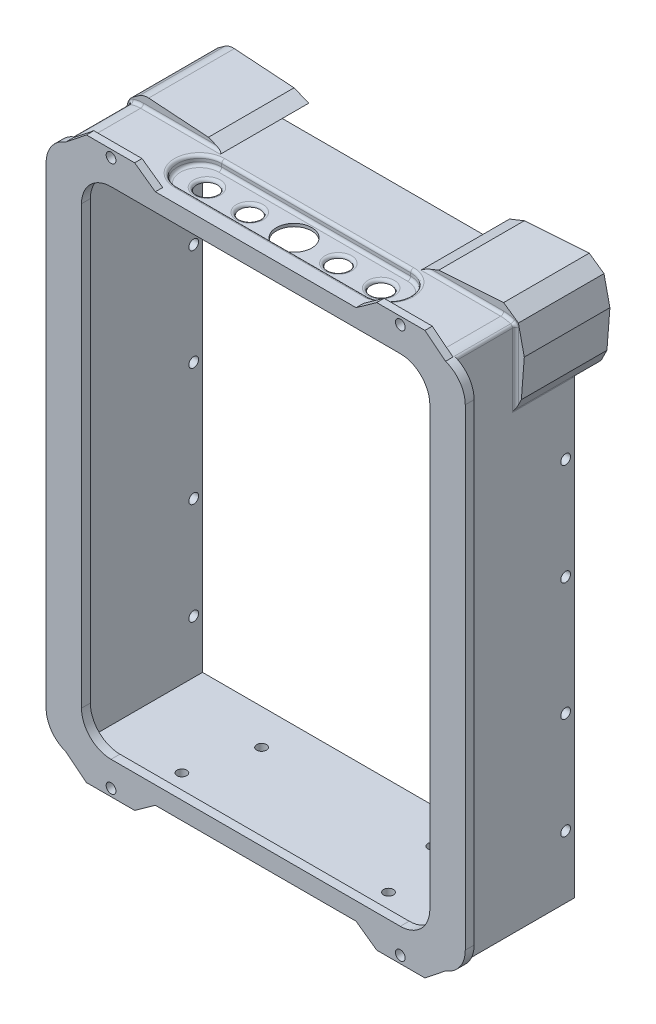
from build123d import *

# Parameters (mm, degrees)
SKETCH_1_W           = 130
SKETCH_1_H           = 180
SKETCH_1_W_2         = 122
SKETCH_1_H_2         = 172
EXTRUDE_1_DEPTH      = 40
EXTRUDE_START        = 40
SKETCH_3_W           = 142
SKETCH_3_H           = 180
SKETCH_3_W_2         = 118
SKETCH_3_H_2         = 168
EXTRUDE_2_DEPTH      = 3
FILLET_1_R           = 10
SKETCH_4_R           = 1.65
CUT_EXTRUDE_1_DEPTH  = 4
EXTRUDE_3_DEPTH      = 4
CUT_EXTRUDE_2_DEPTH  = 3
SKETCH_8_R           = 6
SKETCH_8_R_2         = 3.5
CUT_EXTRUDE_3_DEPTH  = 4
EXTRUDE_4_DEPTH      = 9
EXTRUDE_4_DEPTH_BACK = 20
FILLET_4_R           = 1
FILLET_5_R           = 5
EXTRUDE_5_DEPTH      = 2.5
SKETCH_13_R          = 1.65
CUT_EXTRUDE_4_DEPTH  = 3
FILLET_6_R           = 1
FILLET_7_R           = 1
FILLET_8_R           = 1
SKETCH_15_R          = 1.65
CUT_EXTRUDE_5_DEPTH  = 126


with BuildPart() as part:
    # 草图1 → 凸台-拉伸1 (new body)
    with BuildSketch(Plane.XY):
        Rectangle(SKETCH_1_W, SKETCH_1_H)
        Rectangle(SKETCH_1_W_2, SKETCH_1_H_2, mode=Mode.SUBTRACT)
    extrude(amount=EXTRUDE_1_DEPTH)

    # 草图3 → 凸台-拉伸2 (add)
    with BuildSketch(Plane.XY.offset(EXTRUDE_START)):
        Rectangle(SKETCH_3_W, SKETCH_3_H)
        Rectangle(SKETCH_3_W_2, SKETCH_3_H_2, mode=Mode.SUBTRACT)
    extrude(amount=EXTRUDE_2_DEPTH)

    # 圆角1
    fillet_1_edges = [part.edges().sort_by_distance(p)[0] for p in [
        (59, 84, 41.5),
        (71, 90, 41.5),
        (-71, 90, 41.5),
        (-59, 84, 41.5),
        (59, -84, 41.5),
        (71, -90, 41.5),
        (-59, -84, 41.5),
        (-71, -90, 41.5),
    ]]
    fillet(fillet_1_edges, radius=FILLET_1_R)

    # 草图4 → 切除-拉伸1 (cut)
    with BuildSketch(Plane.XZ.offset(90)):
        with Locations(Location((-35, 33, 0), (0, 0, 270))):
            Circle(SKETCH_4_R)
        with Locations(Location((35, 33, 0), (0, 0, 180))):
            Circle(SKETCH_4_R)
        with Locations(Location((-29, 12, 0), (0, 0, 270))):
            Circle(SKETCH_4_R)
        with Locations(Location((29, 12, 0), (0, 0, 180))):
            Circle(SKETCH_4_R)
    extrude(amount=-CUT_EXTRUDE_1_DEPTH, mode=Mode.SUBTRACT)

    # 草图5 → 凸台-拉伸3 (add)
    # profile 1 of 2: a face of its own
    with BuildSketch(Plane.XZ.offset(90)):
        Polygon((-32.17338561, 38.034241196), (-37.94647357, 37.965040467), (-40.77308796, 32.930799271), (-37.82661439, 27.965758804), (-32.05352643, 28.034959533), (-29.22691204, 33.069200729), align=None)
        Polygon((-33.021369927, 36.523968837), (-37.062531499, 36.475528327), (-39.041161572, 32.951559489), (-36.978630073, 29.476031163), (-32.937468501, 29.524471673), (-30.958838428, 33.048440511), align=None, mode=Mode.SUBTRACT)
    # profile 2 of 2: a face of its own
    with BuildSketch(Plane.XZ.offset(90)):
        Polygon((40.77308796, 32.930799271), (37.82661439, 27.965758804), (32.05352643, 28.034959533), (29.22691204, 33.069200729), (32.17338561, 38.034241196), (37.94647357, 37.965040467), align=None)
        Polygon((39.041161572, 32.951559489), (36.978630073, 29.476031163), (32.937468501, 29.524471673), (30.958838428, 33.048440511), (33.021369927, 36.523968837), (37.062531499, 36.475528327), align=None, mode=Mode.SUBTRACT)
    extrude(amount=EXTRUDE_3_DEPTH)

    # 草图7 → 切除-拉伸2 (cut)
    with BuildSketch(Plane(origin=(0, 90, 0), x_dir=(1, 0, 0), z_dir=(0, 1, 0))):
        with BuildLine():
            Line((32, -37.5), (-32, -37.5))
            ThreePointArc((-32, -37.5), (-39.5, -30), (-32, -22.5))
            Line((-32, -22.5), (32, -22.5))
            ThreePointArc((32, -22.5), (39.5, -30), (32, -37.5))
        make_face()
    extrude(amount=-CUT_EXTRUDE_2_DEPTH, mode=Mode.SUBTRACT)

    # 草图8 → 切除-拉伸3 (cut)
    with BuildSketch(Plane(origin=(0, 90, 0), x_dir=(1, 0, 0), z_dir=(0, 1, 0))):
        with Locations(Location((0, -30, 0), (0, 0, 270))):
            Circle(SKETCH_8_R)
        with Locations(Location((-15, -30, 0), (0, 0, 270))):
            Circle(SKETCH_8_R_2)
        with Locations(Location((-29.5, -30, 0), (0, 0, 270))):
            Circle(SKETCH_8_R_2)
        with Locations(Location((29.5, -30, 0), (0, 0, 270))):
            Circle(SKETCH_8_R_2)
        with Locations(Location((15, -30, 0), (0, 0, 270))):
            Circle(SKETCH_8_R_2)
    extrude(amount=-CUT_EXTRUDE_3_DEPTH, mode=Mode.SUBTRACT)

    # 草图11 → 凸台-拉伸4 (add, two sides: drawn at the far end of the back side and taken through both)
    with BuildSketch(Plane(origin=(0, 0, 0), x_dir=(-1, 0, 0), z_dir=(0, 0, -1)).offset(-EXTRUDE_4_DEPTH_BACK)):
        with BuildLine():
            Line((39, 92), (34, 90))
            Line((34, 90), (61, 90))
            ThreePointArc((61, 90), (63.043096437, 89.789063129), (65, 89.16515139))
            Line((65, 89.16515139), (65, 64))
            Line((65, 64), (67, 68))
            Line((67, 68), (68, 81))
            Line((68, 81), (66, 90))
            Line((66, 90), (61, 93.5))
            Line((61, 93.5), (39, 92))
        make_face()
        with BuildLine():
            Line((-67, 68), (-65, 64))
            Line((-65, 64), (-65, 89.16515139))
            ThreePointArc((-65, 89.16515139), (-63.043096437, 89.789063129), (-61, 90))
            Line((-61, 90), (-34, 90))
            Line((-34, 90), (-39, 92))
            Line((-39, 92), (-61, 93.5))
            Line((-61, 93.5), (-66, 90))
            Line((-66, 90), (-68, 81))
            Line((-68, 81), (-67, 68))
        make_face()
    extrude(amount=EXTRUDE_4_DEPTH + EXTRUDE_4_DEPTH_BACK)

    # 圆角4
    fillet_4_edges = [part.edges().sort_by_distance(p)[0] for p in [
        (-65, 64, 10),
        (-65, 76.582575695, 20),
        (-63.043096437, 89.789063129, 20),
        (-47.5, 90, 20),
        (65, 89.16515139, 30),
        (65, 64, 10),
        (47.5, 90, 20),
        (63.043096437, 89.789063129, 20),
        (65, 76.582575695, 20),
        (-65, 89.16515139, 30),
    ]]
    fillet(fillet_4_edges, radius=FILLET_4_R)

    # 圆角5
    fillet_5_edges = [part.edges().sort_by_distance(p)[0] for p in [
        (-68, 81, 5.5),
        (-66, 90, 5.5),
        (-61, 93.5, 5.5),
    ]]
    fillet(fillet_5_edges, radius=FILLET_5_R)

    # 草图12 → 凸台-拉伸5 (add)
    with BuildSketch(Plane.XY.offset(43)):
        with BuildLine():
            Line((64.333333333, 89.428090416), (57.333333333, 95))
            Line((57.333333333, 95), (41, 95))
            Line((41, 95), (34, 90))
            Line((34, 90), (61, 90))
            ThreePointArc((61, 90), (62.691019787, 89.855985597), (64.333333333, 89.428090416))
        make_face()
        with BuildLine():
            Line((-34, 90), (-61, 90))
            ThreePointArc((-61, 90), (-62.691019787, 89.855985597), (-64.333333333, 89.428090416))
            Line((-64.333333333, 89.428090416), (-57.333333333, 95))
            Line((-57.333333333, 95), (-41, 95))
            Line((-41, 95), (-34, 90))
        make_face()
        with BuildLine():
            Line((34, -90), (61, -90))
            ThreePointArc((61, -90), (62.691019787, -89.855985597), (64.333333333, -89.428090416))
            Line((64.333333333, -89.428090416), (57.333333333, -95))
            Line((57.333333333, -95), (41, -95))
            Line((41, -95), (34, -90))
        make_face()
        with BuildLine():
            Line((-64.333333333, -89.428090416), (-57.333333333, -95))
            Line((-57.333333333, -95), (-41, -95))
            Line((-41, -95), (-34, -90))
            Line((-34, -90), (-61, -90))
            ThreePointArc((-61, -90), (-62.691019787, -89.855985597), (-64.333333333, -89.428090416))
        make_face()
    extrude(amount=-EXTRUDE_5_DEPTH)

    # 草图13 → 切除-拉伸4 (cut)
    with BuildSketch(Plane(origin=(0, 0, 40.5), x_dir=(-1, 0, 0), z_dir=(0, 0, -1))):
        with Locations((49, 92.5)):
            Circle(SKETCH_13_R)
        with Locations(Location((-49, 92.5, 0), (0, 0, 180))):
            Circle(SKETCH_13_R)
        with Locations((-49, -92.5)):
            Circle(SKETCH_13_R)
        with Locations(Location((49, -92.5, 0), (0, 0, 180))):
            Circle(SKETCH_13_R)
    extrude(amount=-CUT_EXTRUDE_4_DEPTH, mode=Mode.SUBTRACT)

    # 圆角6
    fillet_6_edges = [part.edges().sort_by_distance(p)[0] for p in [
        (15, 87, 26.5),
        (29.5, 87, 26.5),
        (-29.5, 87, 26.5),
        (-15, 87, 26.5),
    ]]
    fillet(fillet_6_edges, radius=FILLET_6_R - 0.0001)  # a hair under: the kernel refuses the full size

    # 圆角7
    fillet_7_edges = [part.edges().sort_by_distance(p)[0] for p in [
        (39.5, 87, 30),
        (0, 87, 37.5),
        (-39.5, 87, 30),
        (0, 87, 22.5),
    ]]
    fillet(fillet_7_edges, radius=FILLET_7_R)

    # 圆角8
    fillet_8_edges = [part.edges().sort_by_distance(p)[0] for p in [
        (39.5, 90, 30),
        (0, 90, 22.5),
        (-39.5, 90, 30),
        (0, 90, 37.5),
    ]]
    fillet(fillet_8_edges, radius=FILLET_8_R)

    # 草图15 → 切除-拉伸5 (cut)
    with BuildSketch(Plane.ZY.offset(65)):
        with Locations((3, -33.5)):
            Circle(SKETCH_15_R)
        with Locations((3, -68)):
            Circle(SKETCH_15_R)
        with Locations((3, 6.5)):
            Circle(SKETCH_15_R)
        with Locations((3, 41)):
            Circle(SKETCH_15_R)
    cut_extrude_5 = extrude(amount=-CUT_EXTRUDE_5_DEPTH, mode=Mode.SUBTRACT)

    # 镜向1: 切除-拉伸5 across plane
    add(cut_extrude_5.mirror(Plane(origin=(0, 0, 0), x_dir=(0, 0, 1), z_dir=(1, 0, 0))), mode=Mode.SUBTRACT)


solid = part.part
